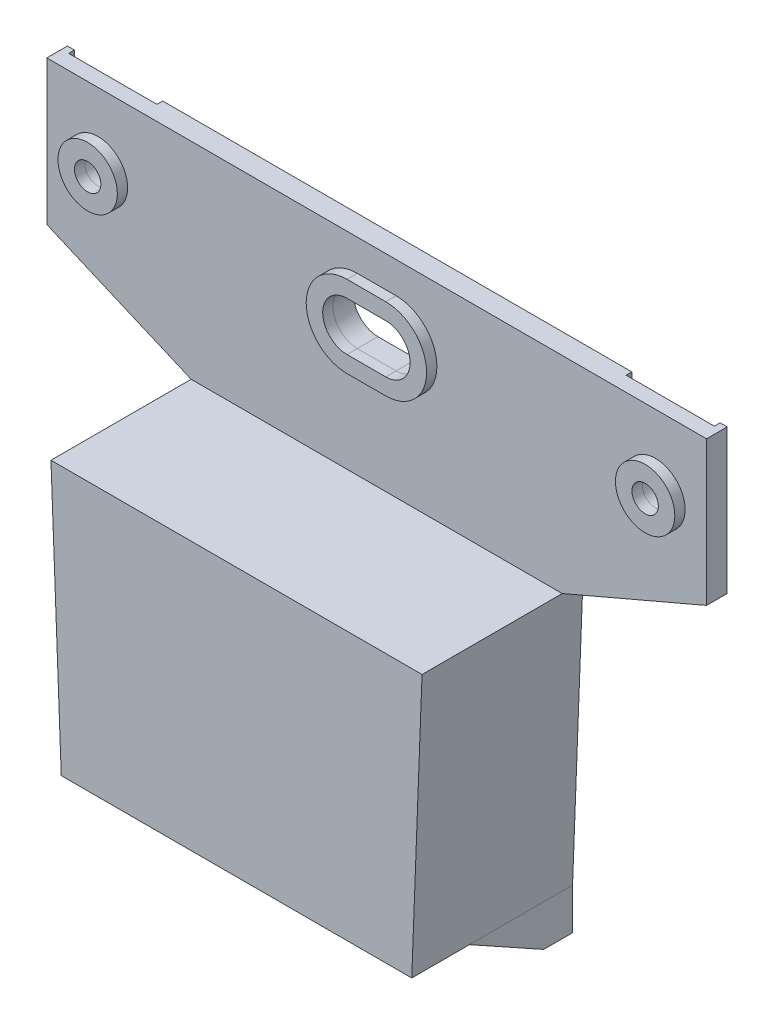
from build123d import *

# Parameters (mm, degrees)
MAIN_BODY_DEPTH                    = 6.35
POCKET_OUTER_SURFACE_DEPTH         = 43.18
POCKET_INSIDE_DEPTH                = 44.45
SKETCH8_W                          = 12.7
SKETCH8_H                          = 31.75
BOTTOM_SCREW_MOUNT_DEPTH           = 12.7
BOTTOM_SCREW_MOUNT_EXTRUSION_DEPTH = 218.712414724
LIGHT_SOCKETS_DEPTH                = 184.078329957
LIGHT_SOCKETS_DEPTH_BACK           = 6.35
SKETCH17_R                         = 4.064
SKETCH18_R                         = 9.144
LIGHT_LIP_LINERS_DEPTH             = 3.175
LIGHT_LIP_SOCKETS_REACH            = 185.078
SKETCH17_2_R                       = 4.064
TAB_SLOTS_DEPTH                    = 1.778
F_1_4_0_25_DIAMETER_HOLE1_D        = 6.35


# Sheet-metal steps are written as plain solids
with BuildPart() as part:
    # Sketch1 → Main Body (new body)
    with BuildSketch(Plane.XY):
        Polygon((-53.975, 0), (53.975, 0), (57.15, 82.55), (101.6, 101.6), (101.6, 146.05), (-101.6, 146.05), (-101.6, 101.6), (-57.15, 82.55), align=None)
    extrude(amount=-MAIN_BODY_DEPTH)

    # Sketch6 → Pocket-Outer Surface (add)
    with BuildSketch(Plane.XY):
        Polygon((53.975, 0), (-53.975, 0), (-57.15, 82.55), (57.15, 82.55), align=None)
    extrude(amount=POCKET_OUTER_SURFACE_DEPTH)

    # Sketch7 → Pocket-Inside (cut)
    with BuildSketch(Plane(origin=(0, 0, -6.35), x_dir=(-1, 0, 0), z_dir=(0, 0, -1))):
        Polygon((-50.551074221, 76.2), (-47.864535759, 6.35), (47.864535759, 6.35), (50.551074221, 76.2), align=None)
    extrude(amount=-POCKET_INSIDE_DEPTH, mode=Mode.SUBTRACT)

    # Sketch8 → Bottom Screw Mount (add)
    with BuildSketch(Plane.XZ):
        with Locations((-47.625, 9.525)):
            Rectangle(SKETCH8_W, SKETCH8_H)
    bottom_screw_mount = extrude(amount=BOTTOM_SCREW_MOUNT_DEPTH)

    # Sketch9 → Bottom Screw Mount Extrusion (cut, through all)
    with BuildSketch(Plane.ZY.offset(53.975)):
        Polygon((2.54, -12.7), (25.4, -12.7), (25.4, 0), align=None)
    bottom_screw_mount_extrusion = extrude(amount=-BOTTOM_SCREW_MOUNT_EXTRUSION_DEPTH, mode=Mode.SUBTRACT)

    # Left Bottom Screw Mount: Bottom Screw Mount, Bottom Screw Mount Extrusion across plane
    add(bottom_screw_mount.mirror(Plane(origin=(0, 0, 0), x_dir=(0, 0, 1), z_dir=(1, 0, 0))))
    add(bottom_screw_mount_extrusion.mirror(Plane(origin=(0, 0, 0), x_dir=(0, 0, 1), z_dir=(1, 0, 0))), mode=Mode.SUBTRACT)

    # Sketch17 → Light Sockets (cut, two sides: drawn at the far end of the back side and taken through both)
    with BuildSketch(Plane.XY.offset(-LIGHT_SOCKETS_DEPTH_BACK)):
        with Locations((85.852, 123.825)):
            Circle(SKETCH17_R)
        with Locations((-85.852, 123.825)):
            Circle(SKETCH17_R)
        with BuildLine():
            Line((-5.969, 131.318), (5.969, 131.318))
            ThreePointArc((5.969, 131.318), (13.462, 123.825), (5.969, 116.332))
            Line((5.969, 116.332), (-5.969, 116.332))
            ThreePointArc((-5.969, 116.332), (-13.462, 123.825), (-5.969, 131.318))
        make_face()
    extrude(amount=LIGHT_SOCKETS_DEPTH + LIGHT_SOCKETS_DEPTH_BACK, mode=Mode.SUBTRACT)

    # Sketch18 → Light Lip Liners (add)
    with BuildSketch(Plane.XY):
        with Locations((-85.852, 123.825)):
            Circle(SKETCH18_R)
        with Locations((85.852, 123.825)):
            Circle(SKETCH18_R)
        with BuildLine():
            Line((5.969, 136.398), (-5.969, 136.398))
            ThreePointArc((-5.969, 136.398), (-18.542, 123.825), (-5.969, 111.252))
            Line((-5.969, 111.252), (5.969, 111.252))
            ThreePointArc((5.969, 111.252), (18.542, 123.825), (5.969, 136.398))
        make_face()
    extrude(amount=LIGHT_LIP_LINERS_DEPTH)

    # Sketch17<2> → Light Lip Sockets (cut, up to next)
    with BuildSketch(Plane.XY, mode=Mode.PRIVATE) as light_lip_sockets_sk1:
        with Locations((85.852, 123.825)):
            Circle(SKETCH17_2_R)
    light_lip_sockets_tool1 = extrude(light_lip_sockets_sk1.sketch, amount=LIGHT_LIP_SOCKETS_REACH, mode=Mode.PRIVATE) & part.part
    # Sketch17<2> → Light Lip Sockets (cut, up to next)
    with BuildSketch(Plane.XY, mode=Mode.PRIVATE) as light_lip_sockets_sk2:
        with Locations((-85.852, 123.825)):
            Circle(SKETCH17_2_R)
    light_lip_sockets_tool2 = extrude(light_lip_sockets_sk2.sketch, amount=LIGHT_LIP_SOCKETS_REACH, mode=Mode.PRIVATE) & part.part
    # Sketch17<2> → Light Lip Sockets (cut, up to next)
    with BuildSketch(Plane.XY, mode=Mode.PRIVATE) as light_lip_sockets_sk3:
        with BuildLine():
            Line((-5.969, 131.318), (5.969, 131.318))
            ThreePointArc((5.969, 131.318), (13.462, 123.825), (5.969, 116.332))
            Line((5.969, 116.332), (-5.969, 116.332))
            ThreePointArc((-5.969, 116.332), (-13.462, 123.825), (-5.969, 131.318))
        make_face()
    light_lip_sockets_tool3 = extrude(light_lip_sockets_sk3.sketch, amount=LIGHT_LIP_SOCKETS_REACH, mode=Mode.PRIVATE) & part.part
    add(light_lip_sockets_tool1.solids().sort_by_distance((85.852, 123.825, 0))[0], mode=Mode.SUBTRACT)
    add(light_lip_sockets_tool2.solids().sort_by_distance((-85.852, 123.825, 0))[0], mode=Mode.SUBTRACT)
    add(light_lip_sockets_tool3.solids().sort_by_distance((0, 123.825, 0))[0], mode=Mode.SUBTRACT)

    # Sketch19 → Tab Slots (cut)
    with BuildSketch(Plane(origin=(0, 0, -6.35), x_dir=(-1, 0, 0), z_dir=(0, 0, -1))):
        with BuildLine():
            Line((72.263, 146.05), (72.263, 123.825))
            ThreePointArc((72.263, 123.825), (85.852, 110.236), (99.441, 123.825))
            Line((99.441, 123.825), (99.441, 146.05))
            Line((99.441, 146.05), (72.263, 146.05))
        make_face()
    tab_slots = extrude(amount=-TAB_SLOTS_DEPTH, mode=Mode.SUBTRACT)

    # Mirror3: Tab Slots across plane
    add(tab_slots.mirror(Plane(origin=(0, 0, 0), x_dir=(0, 0, 1), z_dir=(1, 0, 0))), mode=Mode.SUBTRACT)

    # 1/4 (0.25) Diameter Hole1 (through all)
    with Locations(Plane(origin=(0, 0, -6.35), x_dir=(-1, 0, 0), z_dir=(0, 0, -1))):
        with Locations((-47.625, -6.35), (47.625, -6.35)):
            Hole(F_1_4_0_25_DIAMETER_HOLE1_D / 2)


solid = part.part
